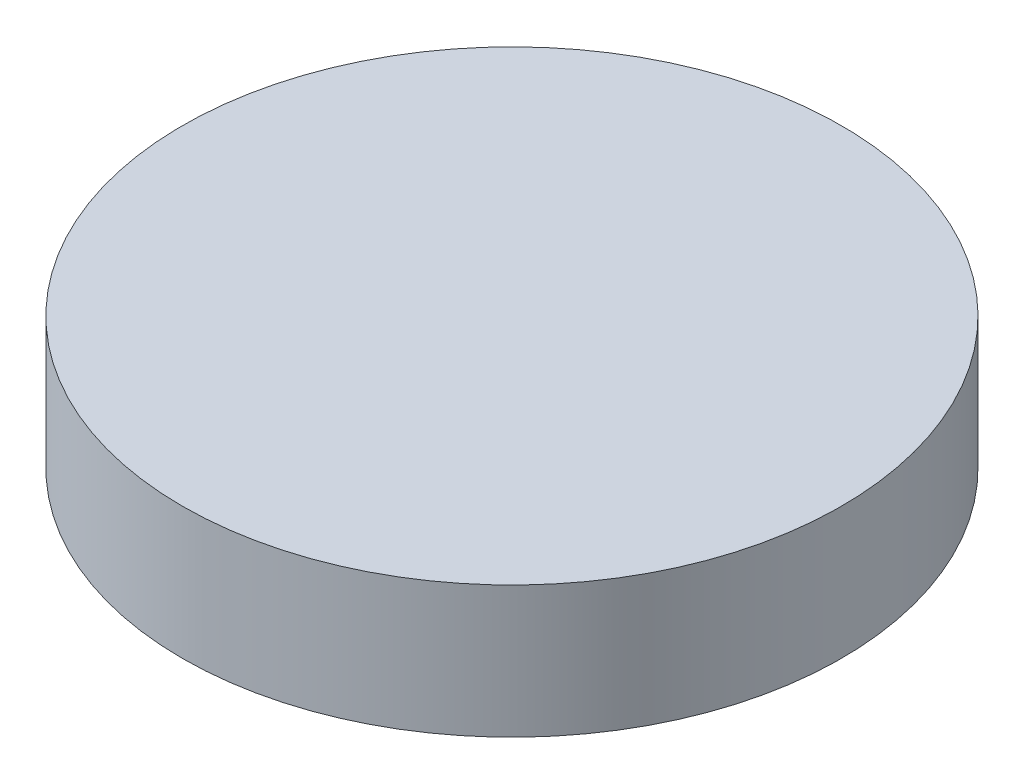
from build123d import *

# Parameters (mm, degrees)
SKETCH1_R           = 3.175
BOSS_EXTRUDE1_DEPTH = 1.27


with BuildPart() as part:
    # Sketch1 → Boss-Extrude1 (new body)
    with BuildSketch(Plane(origin=(0, 0, 0), x_dir=(1, 0, 0), z_dir=(0, 1, 0))):
        Circle(SKETCH1_R)
    extrude(amount=BOSS_EXTRUDE1_DEPTH)


solid = part.part
